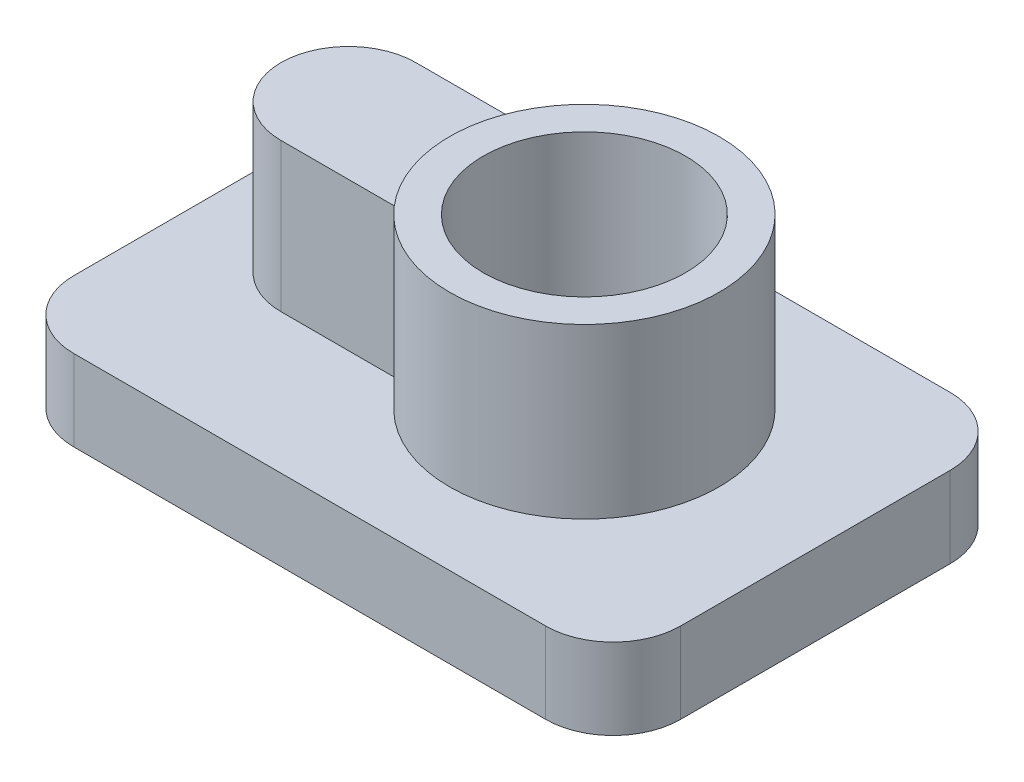
from build123d import *

# Parameters (mm, degrees)
ESBO_O1_W                = 90
ESBO_O1_H                = 12
RESSALTO_EXTRUS_O1_DEPTH = 60
FILETE2_R                = 10
FILETE3_R                = 10
FILETE4_R                = 10
ESBO_O5_R                = 20
RESSALTO_EXTRUS_O3_DEPTH = 25
RESSALTO_EXTRUS_O4_DEPTH = 22
ESBO_O9_R                = 15
CORTE_EXTRUS_O1_DEPTH    = 37


with BuildPart() as part:
    # Esboço1 → Ressalto-extrusão1 (new body)
    with BuildSketch(Plane.XY):
        with Locations((45, 6)):
            Rectangle(ESBO_O1_W, ESBO_O1_H)
    extrude(amount=RESSALTO_EXTRUS_O1_DEPTH)

    # Filete2
    filete2_edges = [part.edges().sort_by_distance(p)[0] for p in [
        (0, 6, 60),
    ]]
    fillet(filete2_edges, radius=FILETE2_R)

    # Filete3
    filete3_edges = [part.edges().sort_by_distance(p)[0] for p in [
        (0, 6, 0),
    ]]
    fillet(filete3_edges, radius=FILETE3_R)

    # Filete4
    filete4_edges = [part.edges().sort_by_distance(p)[0] for p in [
        (90, 6, 0),
        (90, 6, 60),
    ]]
    fillet(filete4_edges, radius=FILETE4_R)

    # Esboço5 → Ressalto-extrusão3 (add)
    with BuildSketch(Plane(origin=(0, 12, 0), x_dir=(1, 0, 0), z_dir=(0, 1, 0))):
        with Locations((55, -29.261978019)):
            Circle(ESBO_O5_R)
    extrude(amount=RESSALTO_EXTRUS_O3_DEPTH)

    # Esboço8 → Ressalto-extrusão4 (add)
    with BuildSketch(Plane(origin=(0, 12, 0), x_dir=(1, 0, 0), z_dir=(0, 1, 0))):
        with BuildLine():
            Line((55, -39.261978019), (20, -39.261978019))
            ThreePointArc((20, -39.261978019), (10, -29.261978019), (20, -19.261978019))
            Line((20, -19.261978019), (55, -19.261978019))
            ThreePointArc((55, -19.261978019), (65, -29.261978019), (55, -39.261978019))
        make_face()
    extrude(amount=RESSALTO_EXTRUS_O4_DEPTH)

    # Esboço9 → Corte-extrusão1 (cut)
    with BuildSketch(Plane(origin=(0, 37, 0), x_dir=(1, 0, 0), z_dir=(0, 1, 0))):
        with Locations((55, -29.261978019)):
            Circle(ESBO_O9_R)
    extrude(amount=-CORTE_EXTRUS_O1_DEPTH, mode=Mode.SUBTRACT)


solid = part.part
